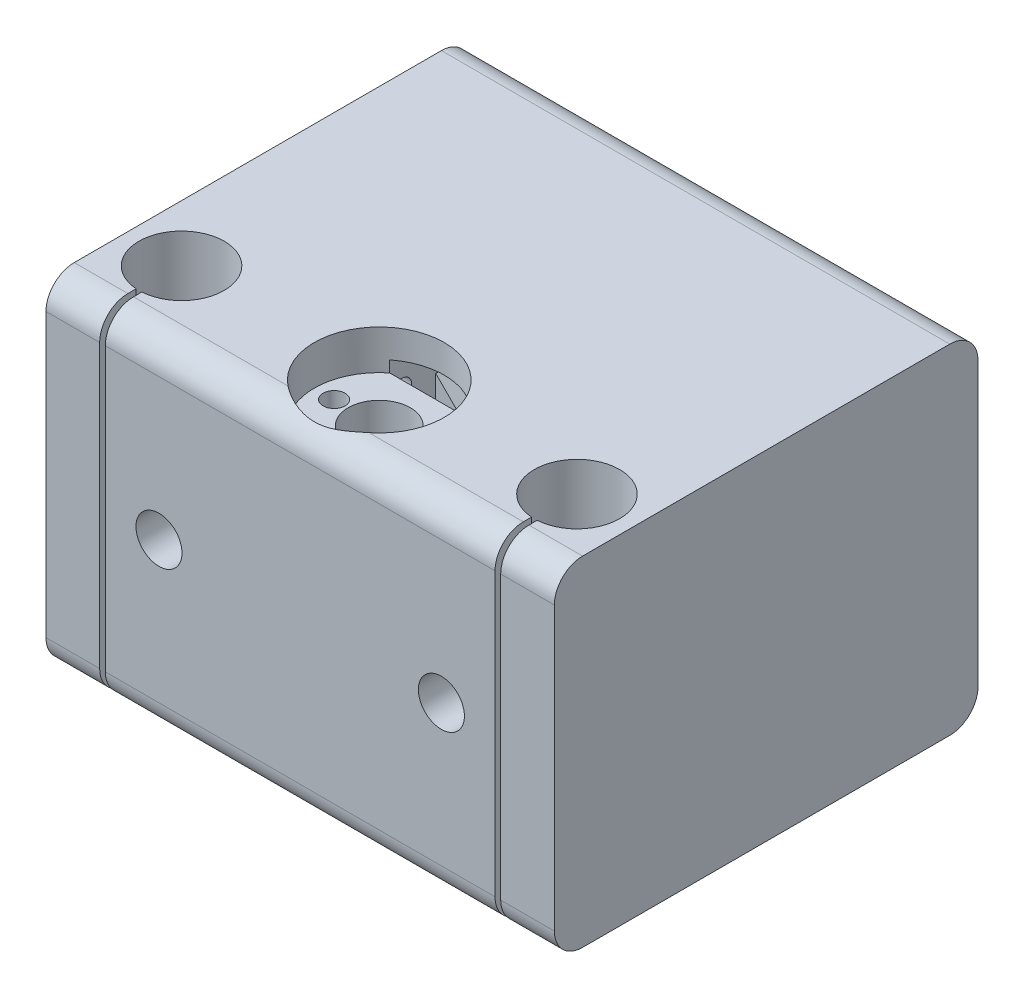
from build123d import *

# Parameters (mm, degrees)
BOSS_EXTRUDE1_DEPTH          = 90
SKETCH2_R                    = 7.55
SKETCH2_R_2                  = 5.5
CUT_EXTRUDE1_DEPTH           = 90
SKETCH3_R                    = 4.075
CUT_EXTRUDE2_DEPTH           = 90
CUT_EXTRUDE3_START           = -42
SKETCH4_W                    = 84
SKETCH4_H                    = 50
SKETCH4_R                    = 4.075
CUT_EXTRUDE3_DEPTH           = 42
SKETCH5_R                    = 11.5
SKETCH5_R_2                  = 1.75
CUT_EXTRUDE4_DEPTH           = 42
SKETCH10_W                   = 1
SKETCH10_H                   = 23.85052841
CUT_EXTRUDE_THIN1_DEPTH      = 70
CHAMFER2_SIZE                = 2
BOSS_EXTRUDE4_DEPTH          = 3
SKETCH15_W                   = 15
SKETCH15_H                   = 60
BOSS_EXTRUDE5_DEPTH          = 3
FILLET1_R                    = 5
SKETCH16_W                   = 84
SKETCH16_H                   = 42
CUT_EXTRUDE5_DEPTH           = 10
BOSS_EXTRUDE6_DEPTH          = 84
BOSS_EXTRUDE7_START          = -9
SKETCH18_R                   = 4.075
BOSS_EXTRUDE7_DEPTH          = 9
CUT_EXTRUDE_THIN3_DEPTH      = 121.933866311
CUT_EXTRUDE_THIN3_DEPTH_BACK = 9
SKETCH21_R                   = 11.5
CUT_EXTRUDE7_DEPTH           = 7
SKETCH22_R                   = 1.95
CUT_EXTRUDE8_DEPTH           = 20
SKETCH23_W                   = 15
SKETCH23_H                   = 5
CUT_EXTRUDE9_DEPTH           = 20
BOSS_EXTRUDE8_REACH          = 103.367
CHAMFER3_SIZE                = 5
CHAMFER4_SIZE                = 5


with BuildPart() as part:
    # Sketch1 → Boss-Extrude1 (new body)
    with BuildSketch(Plane(origin=(0, 0, 0), x_dir=(0, 0, -1), z_dir=(1, 0, 0))):
        with BuildLine():
            Line((-27.5, -30), (27.5, -30))
            ThreePointArc((27.5, -30), (31.035533906, -28.535533906), (32.5, -25))
            Line((32.5, -25), (32.5, 25))
            ThreePointArc((32.5, 25), (31.035533906, 28.535533906), (27.5, 30))
            Line((27.5, 30), (-27.5, 30))
            ThreePointArc((-27.5, 30), (-31.035533906, 28.535533906), (-32.5, 25))
            Line((-32.5, 25), (-32.5, -25))
            ThreePointArc((-32.5, -25), (-31.035533906, -28.535533906), (-27.5, -30))
        make_face()
    extrude(amount=BOSS_EXTRUDE1_DEPTH)

    # Sketch2 → Cut-Extrude1 (cut)
    with BuildSketch(Plane(origin=(0, 30, 0), x_dir=(1, 0, 0), z_dir=(0, 1, 0))):
        with Locations(Location((10, -18.5, 0), (0, 0, 270))):
            Circle(SKETCH2_R)
        with Locations(Location((80, -18.5, 0), (0, 0, 270))):
            Circle(SKETCH2_R)
        with Locations(Location((45, -18.5, 0), (0, 0, 270))):
            Circle(SKETCH2_R_2)
    extrude(amount=-CUT_EXTRUDE1_DEPTH, mode=Mode.SUBTRACT)

    # Sketch3 → Cut-Extrude2 (cut)
    with BuildSketch(Plane.XY.offset(32.5)):
        with Locations((20, 0)):
            Circle(SKETCH3_R)
        with Locations((70, 0)):
            Circle(SKETCH3_R)
    extrude(amount=-CUT_EXTRUDE2_DEPTH, mode=Mode.SUBTRACT)

    # Sketch4 → Cut-Extrude3 (cut)
    with BuildSketch(Plane(origin=(0, 0, -32.5), x_dir=(-1, 0, 0), z_dir=(0, 0, -1)).offset(CUT_EXTRUDE3_START)):
        with Locations((-45, 0)):
            Rectangle(SKETCH4_W, SKETCH4_H)
        with Locations(Location((-70, 0, 0), (0, 0, 180))):
            Circle(SKETCH4_R, mode=Mode.SUBTRACT)
        with Locations(Location((-20, 0, 0), (0, 0, 180))):
            Circle(SKETCH4_R, mode=Mode.SUBTRACT)
    extrude(amount=CUT_EXTRUDE3_DEPTH, mode=Mode.SUBTRACT)

    # Sketch5 → Cut-Extrude4 (cut)
    with BuildSketch(Plane(origin=(3, 0, 0), x_dir=(0, 0, -1), z_dir=(1, 0, 0))):
        with Locations((12, 0)):
            Circle(SKETCH5_R)
        with Locations((-3.5, 15.5)):
            Circle(SKETCH5_R_2)
        with Locations((27.5, 15.5)):
            Circle(SKETCH5_R_2)
        with Locations((27.5, -15.5)):
            Circle(SKETCH5_R_2)
        with Locations((-3.5, -15.5)):
            Circle(SKETCH5_R_2)
    extrude(amount=-CUT_EXTRUDE4_DEPTH, mode=Mode.SUBTRACT)

    # Sketch10 → Cut-Extrude-Thin1 (cut)
    with BuildSketch(Plane(origin=(0, 30, 0), x_dir=(1, 0, 0), z_dir=(0, 1, 0))):
        with Locations((10, -30.425264205)):
            Rectangle(SKETCH10_W, SKETCH10_H)
        with Locations((80, -30.425264205)):
            Rectangle(SKETCH10_W, SKETCH10_H)
    extrude(amount=-CUT_EXTRUDE_THIN1_DEPTH, mode=Mode.SUBTRACT)

    # Chamfer2
    chamfer2_edges = [part.edges().sort_by_distance(p)[0] for p in [
        (3, 0, -0.5),
    ]]
    chamfer(chamfer2_edges, length=CHAMFER2_SIZE)

    # Sketch14 → Boss-Extrude4 (add)
    with BuildSketch(Plane.ZY):
        with BuildLine():
            Line((-27.5, -30), (-42.5, -30))
            Line((-42.5, -30), (-42.5, 30))
            Line((-42.5, 30), (-27.5, 30))
            ThreePointArc((-27.5, 30), (-31.035533906, 28.535533906), (-32.5, 25))
            Line((-32.5, 25), (-32.5, -25))
            ThreePointArc((-32.5, -25), (-31.035533906, -28.535533906), (-27.5, -30))
        make_face()
    extrude(amount=-BOSS_EXTRUDE4_DEPTH)

    # Sketch15 → Boss-Extrude5 (add)
    with BuildSketch(Plane(origin=(90, 0, 0), x_dir=(0, 0, -1), z_dir=(1, 0, 0))):
        with Locations((35, 0)):
            Rectangle(SKETCH15_W, SKETCH15_H)
    extrude(amount=-BOSS_EXTRUDE5_DEPTH)

    # Fillet1
    fillet1_edges = [part.edges().sort_by_distance(p)[0] for p in [
        (1.5, -30, -42.5),
        (1.5, 30, -42.5),
        (88.5, 30, -42.5),
        (88.5, -30, -42.5),
    ]]
    fillet(fillet1_edges, radius=FILLET1_R)

    # Sketch16 → Cut-Extrude5 (cut)
    with BuildSketch(Plane(origin=(0, -25, 0), x_dir=(1, 0, 0), z_dir=(0, 1, 0))):
        with Locations((45, 11.5)):
            Rectangle(SKETCH16_W, SKETCH16_H)
    extrude(amount=-CUT_EXTRUDE5_DEPTH, mode=Mode.SUBTRACT)

    # Sketch17 → Boss-Extrude6 (add)
    with BuildSketch(Plane(origin=(3, 0, 0), x_dir=(0, 0, -1), z_dir=(1, 0, 0))):
        with BuildLine():
            Line((32.5, 25), (42.5, 25))
            ThreePointArc((42.5, 25), (41.035533906, 28.535533906), (37.5, 30))
            Line((37.5, 30), (27.5, 30))
            ThreePointArc((27.5, 30), (31.035533906, 28.535533906), (32.5, 25))
        make_face()
    extrude(amount=BOSS_EXTRUDE6_DEPTH)

    # Sketch18 → Boss-Extrude7 (add)
    with BuildSketch(Plane(origin=(0, 0, -42.5), x_dir=(-1, 0, 0), z_dir=(0, 0, -1)).offset(BOSS_EXTRUDE7_START)):
        with BuildLine():
            Line((-61, 0), (-61, 25))
            Line((-61, 25), (-87, 25))
            Line((-87, 25), (-87, -9))
            Line((-87, -9), (-70, -9))
            ThreePointArc((-70, -9), (-63.636038969, -6.363961031), (-61, 0))
        make_face()
        with Locations(Location((-70, 0, 0), (0, 0, 180))):
            Circle(SKETCH18_R, mode=Mode.SUBTRACT)
    extrude(amount=BOSS_EXTRUDE7_DEPTH)

    # Sketch19 → Cut-Extrude-Thin3 (cut, two sides: drawn at the far end of the back side and taken through both)
    with BuildSketch(Plane(origin=(0, 0, -42.5), x_dir=(-1, 0, 0), z_dir=(0, 0, -1)).offset(-CUT_EXTRUDE_THIN3_DEPTH_BACK)):
        Polygon((-61.965111244, -7.327781975), (-63.282485579, -6.01040764), (-66.764986476, -2.527906743), (-68.355005201, -0.937888018), (-69.062111982, -1.644994799), (-67.472093257, -3.235013524), (-63.98959236, -6.717514421), (-62.672218025, -8.034888756), align=None)
    extrude(amount=CUT_EXTRUDE_THIN3_DEPTH + CUT_EXTRUDE_THIN3_DEPTH_BACK, mode=Mode.SUBTRACT)

    # Sketch21 → Cut-Extrude7 (cut)
    with BuildSketch(Plane(origin=(0, 30, 0), x_dir=(1, 0, 0), z_dir=(0, 1, 0))):
        with Locations(Location((45, -18.5, 0), (0, 0, 231.500049591))):
            Circle(SKETCH21_R)
    extrude(amount=-CUT_EXTRUDE7_DEPTH, mode=Mode.SUBTRACT)

    # Sketch22 → Cut-Extrude8 (cut)
    with BuildSketch(Plane(origin=(0, 23, 0), x_dir=(1, 0, 0), z_dir=(0, 1, 0))):
        with Locations(Location((53, -18.5, 0), (0, 0, 270))):
            Circle(SKETCH22_R)
        with Locations(Location((45, -26.5, 0), (0, 0, 270))):
            Circle(SKETCH22_R)
        with Locations(Location((37, -18.5, 0), (0, 0, 270))):
            Circle(SKETCH22_R)
    extrude(amount=-CUT_EXTRUDE8_DEPTH, mode=Mode.SUBTRACT)

    # Sketch23 → Cut-Extrude9 (cut)
    with BuildSketch(Plane(origin=(3, 0, 0), x_dir=(0, 0, -1), z_dir=(1, 0, 0))):
        with Locations((12, 22.5)):
            Rectangle(SKETCH23_W, SKETCH23_H)
    extrude(amount=-CUT_EXTRUDE9_DEPTH, mode=Mode.SUBTRACT)

    # Sketch24 → Boss-Extrude8 (add, up to next)
    with BuildSketch(Plane.ZY.offset(-87), mode=Mode.PRIVATE) as boss_extrude8_sk1:
        with BuildLine():
            Line((-42.5, -21), (-33.5, -21))
            Line((-33.5, -21), (-33.5, -30))
            Line((-33.5, -30), (-37.5, -30))
            ThreePointArc((-37.5, -30), (-41.035533906, -28.535533906), (-42.5, -25))
            Line((-42.5, -25), (-42.5, -21))
        make_face()
    boss_extrude8_tool1 = extrude(boss_extrude8_sk1.sketch, amount=BOSS_EXTRUDE8_REACH, mode=Mode.PRIVATE) - part.part
    add(boss_extrude8_tool1.solids().sort_by_distance((87, -25.260021, -37.760021))[0])

    # Chamfer3
    chamfer3_edges = [part.edges().sort_by_distance(p)[0] for p in [
        (87, -9, -38),
        (3, -21, -38),
        (87, -21, -38),
    ]]
    chamfer(chamfer3_edges, length=CHAMFER3_SIZE)

    # Chamfer4
    # the kernel refuses this chamfer: 5 mm, written as the material it adds along each edge
    with BuildSketch(Plane(origin=(61, 25, -33.5), x_dir=(0.027495876610586317, -0.9996219169112968, 0), z_dir=(0, 0, -1))) as chamfer4_piece_1:
        Polygon((CHAMFER4_SIZE * 0.999621916911, CHAMFER4_SIZE * 0.0274958766106), (-CHAMFER4_SIZE * 0.0274958766106, CHAMFER4_SIZE * 0.999621916911), (0, 0), align=None)
    extrude(amount=9)


solid = part.part
